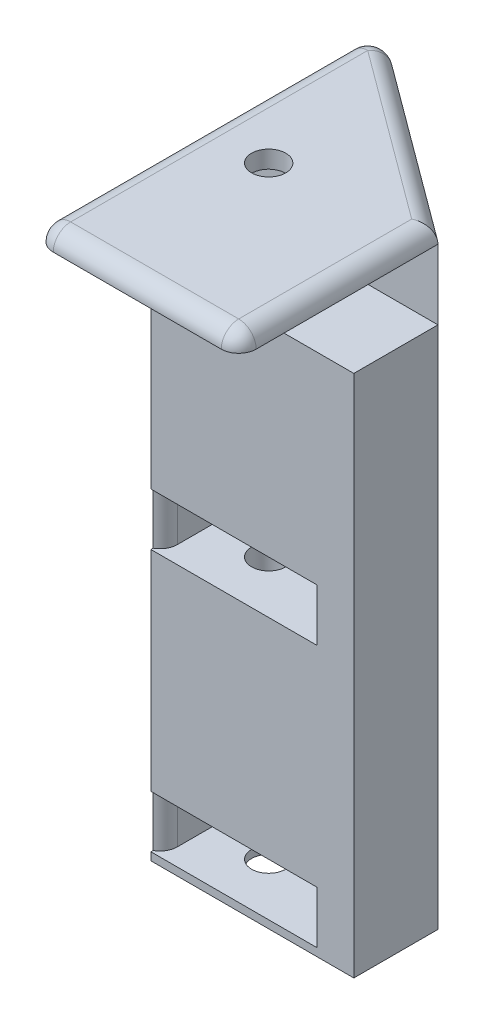
from build123d import *

# Parameters (mm, degrees)
SKETCH1_W               = 29.532117275
SKETCH1_H               = 16.294493356
BOSS_EXTRUDE1_DEPTH     = 6.35
BOSS_EXTRUDE2_DEPTH     = 82.55
SKETCH2_W               = 29.532117275
SKETCH2_H               = 16.294493356
CUT_EXTRUDE1_DEPTH      = 3.175
SKETCH4_W               = 29.532117275
SKETCH4_H               = 12.7
BOSS_EXTRUDE3_DEPTH     = 3.175
SKETCH7_W               = 36.710026843
SKETCH7_H               = 7.62
CUT_EXTRUDE4_DEPTH      = 13.589
SKETCH8_W               = 36.710026843
SKETCH8_H               = 7.62
CUT_EXTRUDE5_DEPTH      = 13.589
SKETCH9_W               = 29.532117275
SKETCH9_H               = 76.2
SKETCH9_W_2             = 22.877365929
SKETCH9_H_2             = 7.62
BOSS_EXTRUDE5_DEPTH     = 12.2428
CUT_EXTRUDE6_DEPTH      = 95.918198917
CUT_EXTRUDE6_DEPTH_BACK = 95.918198917
SKETCH10_R              = 2.4892
FILLET2_R               = 2.54
FILLET3_R               = 2.54
CUT_EXTRUDE7_DEPTH      = 2.54
CUT_EXTRUDE7_DEPTH_BACK = 6.35
SKETCH11_R              = 1.5875
CUT_EXTRUDE8_DEPTH      = 93.343538462
CUT_EXTRUDE8_DEPTH_BACK = 93.343538462
SKETCH12_W              = 28.994493356
SKETCH12_H              = 0.635


with BuildPart() as part:
    # Sketch1 → Boss-Extrude1 (new body)
    with BuildSketch(Plane(origin=(0, 0, 0), x_dir=(1, 0, 0), z_dir=(0, 1, 0))):
        Polygon((16.296436439, 0), (-13.235680836, 21.805506644), (-13.235680836, 0), align=None)
        with Locations((1.530377802, -8.147246678)):
            Rectangle(SKETCH1_W, SKETCH1_H)
    extrude(amount=BOSS_EXTRUDE1_DEPTH)

    # Sketch1<3> → Boss-Extrude2 (add)
    with BuildSketch(Plane(origin=(0, 0, 0), x_dir=(1, 0, 0), z_dir=(0, 1, 0))):
        Polygon((16.296436439, 0), (-13.235680836, 21.805506644), (-13.235680836, 0), align=None)
    extrude(amount=-BOSS_EXTRUDE2_DEPTH)

    # Sketch2 → Cut-Extrude1 (cut)
    with BuildSketch(Plane(origin=(0, 0, 0), x_dir=(-1, 0, 0), z_dir=(0, -1, 0))):
        with Locations((-1.530377802, -8.147246678)):
            Rectangle(SKETCH2_W, SKETCH2_H)
    extrude(amount=-CUT_EXTRUDE1_DEPTH, mode=Mode.SUBTRACT)

    # Sketch4 → Boss-Extrude3 (add)
    with BuildSketch(Plane(origin=(0, 6.35, 0), x_dir=(1, 0, 0), z_dir=(0, 1, 0))):
        with Locations((1.530377802, -22.644493356)):
            Rectangle(SKETCH4_W, SKETCH4_H)
    extrude(amount=-BOSS_EXTRUDE3_DEPTH)

    # Sketch7 → Cut-Extrude4 (cut)
    with BuildSketch(Plane(origin=(3.863909533, 0, -5.233055638), x_dir=(-0.804470053980136, 0, -0.5939932089251503), z_dir=(0.5939932089251503, 0, -0.804470053980136))):
        with Locations((5.24501832, -77.597)):
            Rectangle(SKETCH7_W, SKETCH7_H)
    extrude(amount=-CUT_EXTRUDE4_DEPTH, mode=Mode.SUBTRACT)

    # Sketch8 → Cut-Extrude5 (cut)
    with BuildSketch(Plane(origin=(3.863909533, 0, -5.233055638), x_dir=(-0.804470053980136, 0, -0.5939932089251503), z_dir=(0.5939932089251503, 0, -0.804470053980136))):
        with Locations((5.24501832, -39.497)):
            Rectangle(SKETCH8_W, SKETCH8_H)
    extrude(amount=-CUT_EXTRUDE5_DEPTH, mode=Mode.SUBTRACT)

    # Sketch9 → Boss-Extrude5 (add)
    with BuildSketch(Plane.XY):
        with Locations((1.530377802, -44.45)):
            Rectangle(SKETCH9_W, SKETCH9_H)
        with Locations((-0.487425481, -77.597)):
            Rectangle(SKETCH9_W_2, SKETCH9_H_2, mode=Mode.SUBTRACT)
        with Locations((-0.487425481, -39.497)):
            Rectangle(SKETCH9_W_2, SKETCH9_H_2, mode=Mode.SUBTRACT)
    extrude(amount=BOSS_EXTRUDE5_DEPTH)

    # Sketch10 → Cut-Extrude6 (cut, two sides: drawn at the far end of the back side and taken through both)
    with BuildSketch(Plane(origin=(0, -82.55, 0), x_dir=(-1, 0, 0), z_dir=(0, -1, 0)).offset(-CUT_EXTRUDE6_DEPTH_BACK)):
        with Locations(Location((3.710680836, -4.6228, 0), (0, 0, 270))):
            Circle(SKETCH10_R)
    extrude(amount=CUT_EXTRUDE6_DEPTH + CUT_EXTRUDE6_DEPTH_BACK, mode=Mode.SUBTRACT)

    # Fillet2
    # the kernel refuses this fillet: 2.54 mm, written as the material it takes off along each edge
    with BuildSketch(Plane(origin=(-13.235680836, -95.13201822, -21.805506644), x_dir=(0.8044700539801357, 0, 0.5939932089251506), z_dir=(0, 1, 0))) as fillet2_piece_1:
        with BuildLine():
            CenterArc((FILLET2_R * 1.98142019214, -FILLET2_R), FILLET2_R, 90, 126.440893479)
            Line((FILLET2_R * 1.17695013816, -FILLET2_R * 1.59399320893), (0, 0))
            Line((0, 0), (FILLET2_R * 1.98142019214, 0))
        make_face()
    extrude(amount=114.06403644, mode=Mode.SUBTRACT)
    with BuildSketch(Plane(origin=(-11.926108446, -81.407, 0), x_dir=(-0.8044700539801358, 0, -0.5939932089251506), z_dir=(0, 1, 0))) as fillet2_piece_2:
        with BuildLine():
            CenterArc((FILLET2_R * 0.504688507753, FILLET2_R), FILLET2_R, 216.440893479, 53.559106521)
            Line((-FILLET2_R * 0.299781546228, FILLET2_R * 0.406006791075), (0, 0))
            Line((0, 0), (FILLET2_R * 0.504688507753, 0))
        make_face()
    extrude(amount=7.62, mode=Mode.SUBTRACT)
    with BuildSketch(Plane(origin=(-11.926108446, -81.407, 12.2428), x_dir=(-1, 0, 0), z_dir=(0, 1, 0)), Plane(origin=(-11.926108446, -43.307, 12.2428), x_dir=(-1, 0, 0), z_dir=(0, 1, 0))) as fillet2_piece_3:
        with BuildLine():
            CenterArc((FILLET2_R, -FILLET2_R), FILLET2_R, 90, 90)
            Line((0, -FILLET2_R), (0, 0))
            Line((0, 0), (FILLET2_R, 0))
        make_face()
    extrude(amount=7.62, mode=Mode.SUBTRACT)
    with BuildSketch(Plane(origin=(-11.926108446, -35.687, 0), x_dir=(-0.8044700539801356, 0, -0.5939932089251507), z_dir=(0, -1, 0))) as fillet2_piece_4:
        with BuildLine():
            CenterArc((FILLET2_R * 0.504688507753, -FILLET2_R), FILLET2_R, 90, 53.559106521)
            Line((-FILLET2_R * 0.299781546228, -FILLET2_R * 0.406006791075), (0, 0))
            Line((0, 0), (FILLET2_R * 0.504688507753, 0))
        make_face()
    extrude(amount=7.62, mode=Mode.SUBTRACT)
    with BuildSketch(Plane(origin=(-13.235680836, 12.7, 28.994493356), x_dir=(0, 0, -1), z_dir=(0, -1, 0))) as fillet2_piece_5:
        with BuildLine():
            CenterArc((FILLET2_R, FILLET2_R), FILLET2_R, 180, 90)
            Line((0, FILLET2_R), (0, 0))
            Line((0, 0), (FILLET2_R, 0))
        make_face()
    extrude(amount=15.875, mode=Mode.SUBTRACT)
    with BuildSketch(Plane(origin=(16.296436439, 12.7, 28.994493356), x_dir=(0, 0, -1), z_dir=(0, -1, 0))) as fillet2_piece_6:
        with BuildLine():
            CenterArc((FILLET2_R, -FILLET2_R), FILLET2_R, 90, 90)
            Line((0, -FILLET2_R), (0, 0))
            Line((0, 0), (FILLET2_R, 0))
        make_face()
    extrude(amount=15.875, mode=Mode.SUBTRACT)

    # Fillet3
    fillet3_edges = [part.edges().sort_by_distance(p)[0] for p in [
        (-13.235680836, 6.35, 4.840897),
        (1.530377801, 6.35, 28.994493356),
        (16.296436439, 6.35, 13.227246678),
        (15.552487663, 6.35, 28.25054458),
        (-12.491732061, 6.35, 28.25054458),
        (-11.840100649, 6.35, -19.04027588),
        (3.554749177, 6.35, -9.408026646),
    ]]
    fillet(fillet3_edges, radius=FILLET3_R)

    # Sketch11 → Cut-Extrude7 (cut, two sides: drawn at the far end of the back side and taken through both)
    with BuildSketch(Plane(origin=(5.749837972, 0, -7.787248059), x_dir=(-0.8044700539801359, 0, -0.5939932089251502), z_dir=(0.5939932089251502, 0, -0.8044700539801359)).offset(-CUT_EXTRUDE7_DEPTH_BACK)):
        with Locations(Location((-11.04569204, -62.23, 0), (0, 0, 180))):
            Circle(SKETCH11_R)
        with Locations(Location((1.65430796, -62.23, 0), (0, 0, 180))):
            Circle(SKETCH11_R)
        with Locations(Location((14.35430796, -62.23, 0), (0, 0, 180))):
            Circle(SKETCH11_R)
        with Locations(Location((-11.04569204, -36.83, 0), (0, 0, 180))):
            Circle(SKETCH11_R)
        with Locations(Location((1.65430796, -36.83, 0), (0, 0, 180))):
            Circle(SKETCH11_R)
        with Locations(Location((14.35430796, -36.83, 0), (0, 0, 180))):
            Circle(SKETCH11_R)
        with Locations(Location((-11.04569204, -11.43, 0), (0, 0, 180))):
            Circle(SKETCH11_R)
        with Locations(Location((1.65430796, -11.43, 0), (0, 0, 180))):
            Circle(SKETCH11_R)
        with Locations(Location((14.35430796, -11.43, 0), (0, 0, 180))):
            Circle(SKETCH11_R)
    extrude(amount=CUT_EXTRUDE7_DEPTH + CUT_EXTRUDE7_DEPTH_BACK, mode=Mode.SUBTRACT)

    # Sketch12 → Cut-Extrude8 (cut, two sides: drawn at the far end of the back side and taken through both)
    with BuildSketch(Plane(origin=(16.296436439, 0, 0), x_dir=(0, 0, -1), z_dir=(1, 0, 0)).offset(-CUT_EXTRUDE8_DEPTH_BACK)):
        with Locations((-14.497246678, 3.4925)):
            Rectangle(SKETCH12_W, SKETCH12_H)
    extrude(amount=CUT_EXTRUDE8_DEPTH + CUT_EXTRUDE8_DEPTH_BACK, mode=Mode.SUBTRACT)


solid = part.part
